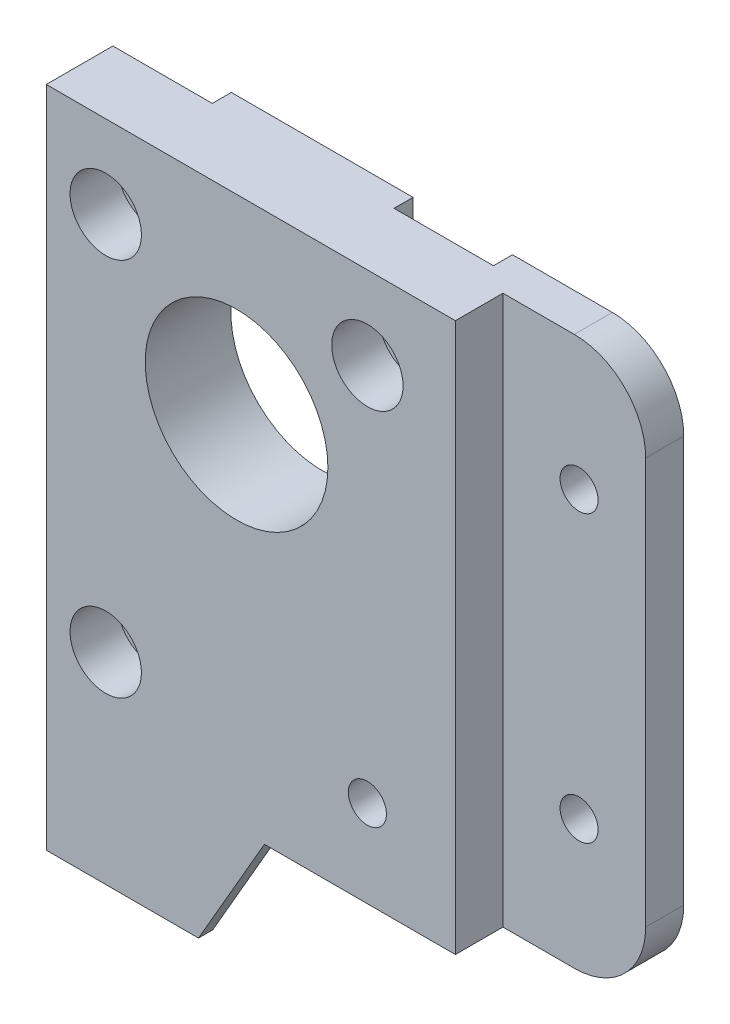
from build123d import *

# Parameters (mm, degrees)
SKETCH1_R           = 4.2
SKETCH1_R_2         = 9.6
BOSS_EXTRUDE1_DEPTH = 2
SKETCH4_W           = 58
SKETCH4_H           = 57.7
SKETCH4_R           = 2
SKETCH4_R_2         = 9.6
BOSS_EXTRUDE3_DEPTH = 2
SKETCH5_R           = 2
CUT_EXTRUDE1_DEPTH  = 4
SKETCH6_W           = 43
SKETCH6_H           = 57.7
SKETCH6_R           = 3.75
SKETCH6_R_2         = 9.6
SKETCH6_R_3         = 2
BOSS_EXTRUDE4_DEPTH = 5
CUT_EXTRUDE2_DEPTH  = 48.972101267
BOSS_EXTRUDE5_DEPTH = 6
BOSS_EXTRUDE6_DEPTH = 1.5


with BuildPart() as part:
    # Sketch1 → Boss-Extrude1 (new body)
    with BuildSketch(Plane.XY):
        with BuildLine():
            Line((38, 28.85), (20, 28.85))
            Line((20, 28.85), (20, 21.79369023))
            Line((20, 21.79369023), (17.201699017, 17.757141063))
            ThreePointArc((17.201699017, 17.757141063), (12.496432266, 16.141438171), (9.55, 20.15))
            Line((9.55, 20.15), (9.55, 28.85))
            Line((9.55, 28.85), (-9.55, 28.85))
            Line((-9.55, 28.85), (-9.55, 20.15))
            ThreePointArc((-9.55, 20.15), (-12.496432266, 16.141438171), (-17.201699017, 17.757141063))
            Line((-17.201699017, 17.757141063), (-20, 21.79369023))
            Line((-20, 21.79369023), (-20, -16.371914064))
            Line((-20, -16.371914064), (-16.312, -16.371914064))
            Line((-16.312, -16.371914064), (-12.349992933, -13.321914064))
            ThreePointArc((-12.349992933, -13.321914064), (-6.459906996, -14.088), (-7.225992933, -19.978085936))
            Line((-7.225992933, -19.978085936), (-11.188, -23.028085936))
            ThreePointArc((-11.188, -23.028085936), (-12.396848296, -23.676050863), (-13.75, -23.9))
            Line((-13.75, -23.9), (-13.75, -28.85))
            Line((-13.75, -28.85), (9.55, -28.85))
            Line((9.55, -28.85), (9.55, -19.7))
            ThreePointArc((9.55, -19.7), (12.496432266, -15.691438171), (17.201699017, -17.307141063))
            Line((17.201699017, -17.307141063), (20, -21.34369023))
            Line((20, -21.34369023), (20, -28.85))
            Line((20, -28.85), (38, -28.85))
            Line((38, -28.85), (38, 28.85))
        make_face()
        with Locations((-5.725, -6.1)):
            Circle(SKETCH1_R, mode=Mode.SUBTRACT)
        with Locations((5.725, -6.1)):
            Circle(SKETCH1_R, mode=Mode.SUBTRACT)
        with Locations((0, 8.8)):
            Circle(SKETCH1_R_2, mode=Mode.SUBTRACT)
    extrude(amount=BOSS_EXTRUDE1_DEPTH)

    # Sketch4 → Boss-Extrude3 (add)
    with BuildSketch(Plane.XY.offset(2)):
        with Locations((9, 0)):
            Rectangle(SKETCH4_W, SKETCH4_H)
        with Locations((13.75, -19.7)):
            Circle(SKETCH4_R, mode=Mode.SUBTRACT)
        with Locations((-13.75, 20.15)):
            Circle(SKETCH4_R, mode=Mode.SUBTRACT)
        with Locations((13.75, 20.15)):
            Circle(SKETCH4_R, mode=Mode.SUBTRACT)
        with Locations((-13.75, -19.7)):
            Circle(SKETCH4_R, mode=Mode.SUBTRACT)
        with Locations((0, 8.8)):
            Circle(SKETCH4_R_2, mode=Mode.SUBTRACT)
    extrude(amount=BOSS_EXTRUDE3_DEPTH)

    # Sketch5 → Cut-Extrude1 (cut)
    with BuildSketch(Plane.XY.offset(4)):
        with Locations((31, 15)):
            Circle(SKETCH5_R)
        with Locations((31, -15)):
            Circle(SKETCH5_R)
    extrude(amount=-CUT_EXTRUDE1_DEPTH, mode=Mode.SUBTRACT)

    # Sketch6 → Boss-Extrude4 (add)
    with BuildSketch(Plane.XY.offset(4)):
        with Locations((1.5, 0)):
            Rectangle(SKETCH6_W, SKETCH6_H)
        with Locations((-13.75, -19.7)):
            Circle(SKETCH6_R, mode=Mode.SUBTRACT)
        with Locations((0, 8.8)):
            Circle(SKETCH6_R_2, mode=Mode.SUBTRACT)
        with Locations((-13.75, 20.15)):
            Circle(SKETCH6_R, mode=Mode.SUBTRACT)
        with Locations((13.75, 20.15)):
            Circle(SKETCH6_R, mode=Mode.SUBTRACT)
        with Locations((13.75, -19.7)):
            Circle(SKETCH6_R_3, mode=Mode.SUBTRACT)
    extrude(amount=BOSS_EXTRUDE4_DEPTH)

    # Sketch7 → Cut-Extrude2 (cut, through all)
    with BuildSketch(Plane.XY.offset(4)):
        with BuildLine():
            Line((30.5, 28.85), (38, 28.85))
            Line((38, 28.85), (38, 21.35))
            ThreePointArc((38, 21.35), (35.803300859, 26.653300859), (30.5, 28.85))
        make_face()
        with BuildLine():
            Line((38, -28.85), (38, -21.35))
            ThreePointArc((38, -21.35), (35.803300859, -26.653300859), (30.5, -28.85))
            Line((30.5, -28.85), (38, -28.85))
        make_face()
    extrude(amount=-CUT_EXTRUDE2_DEPTH, mode=Mode.SUBTRACT)

    # Sketch9 → Boss-Extrude5 (add)
    with BuildSketch(Plane.ZY.offset(20)):
        Polygon((9, -28.85), (9, -40.85), (0, -40.85), (0, -35.15), (3, -35.15), (3, -28.85), align=None)
    extrude(amount=-BOSS_EXTRUDE5_DEPTH)

    # Sketch10 → Boss-Extrude6 (add)
    with BuildSketch(Plane.XY.offset(9)):
        Polygon((-14, -40.85), (-4, -40.85), (2.92820323, -28.85), (-14, -28.85), align=None)
    extrude(amount=-BOSS_EXTRUDE6_DEPTH)


solid = part.part
